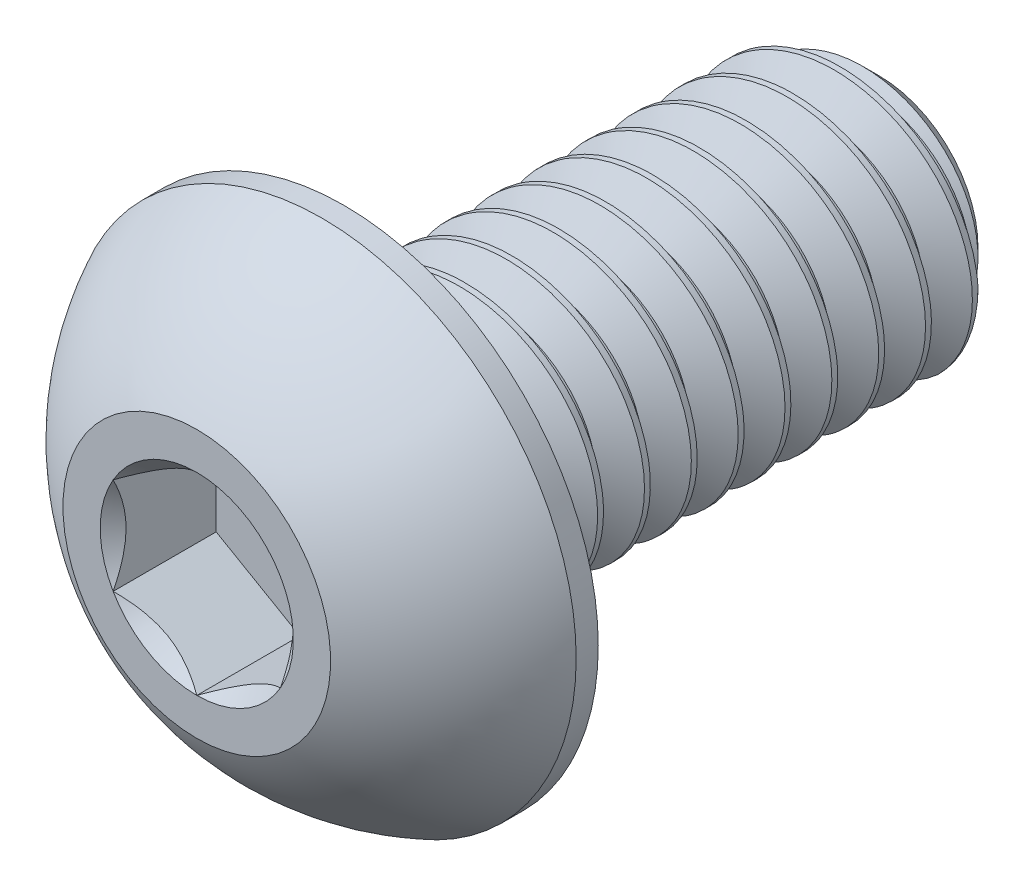
from build123d import *

# Parameters (mm, degrees)
SKETCH1_W          = 8
SKETCH1_H          = 2
CHAMFER1_SIZE      = 0.525
CUT_SWEEP1_PITCH   = 0.7
CUT_EXTRUDE2_DEPTH = 1.54


with BuildPart() as part:
    # Sketch1 → Revolve1 (revolve)
    with BuildSketch(Plane(origin=(0, 0, 0), x_dir=(0, 0, -1), z_dir=(1, 0, 0))):
        with Locations((6.2, 1)):
            Rectangle(SKETCH1_W, SKETCH1_H)
    revolve(axis=Axis((0, 0, -10.2), (0, 0, 1)))

    # Chamfer1
    chamfer1_edges = [part.edges().sort_by_distance(p)[0] for p in [
        (0, -2, -10.2),
    ]]
    chamfer(chamfer1_edges, length=CHAMFER1_SIZE)

    # Cut-Sweep1: the profile of Sketch2 profile screwed along a right-hand helix of 12.428571 turns, 6 arcs to a turn; built about Z, then put on its axis
    cut_sweep1_z = Axis((0, 0, 0), (0, 0, 1))
    cut_sweep1_corners = [(2.0003, 0, 0.000173205), (2.0003, 0, -0.612673205), (1.545336663, 0, -0.35), (1.545336663, 0, -0.2625)]
    with BuildLine(mode=Mode.PRIVATE) as cut_sweep1_profile:
        Line(cut_sweep1_corners[0], cut_sweep1_corners[1])
        Line(cut_sweep1_corners[1], cut_sweep1_corners[2])
        Line(cut_sweep1_corners[2], cut_sweep1_corners[3])
        Line(cut_sweep1_corners[3], cut_sweep1_corners[0])
    cut_sweep1_cap = Face(cut_sweep1_profile.wire())
    cut_sweep1_turn_angles = [0, 30, 60, 90, 120, 150, 180, 210, 240, 270, 300, 330, 360]
    cut_sweep1_turn_weights = [1, 0.8660254037844387, 1, 0.8660254037844387, 1, 0.8660254037844387, 1, 0.8660254037844387, 1, 0.8660254037844387, 1, 0.8660254037844387, 1]
    cut_sweep1_turn_rails = [Edge.make_bspline([Vector(p[0], p[1], 0).rotate(cut_sweep1_z, cut_sweep1_turn_angles[k]) / cut_sweep1_turn_weights[k] + Vector(0, 0, p[2] + CUT_SWEEP1_PITCH * cut_sweep1_turn_angles[k] / 360) for k in range(13)], [0, 0, 0, 1, 1, 2, 2, 3, 3, 4, 4, 5, 5, 6, 6, 6], 2, cut_sweep1_turn_weights) for p in cut_sweep1_corners]
    cut_sweep1_turn_sides = [Face.make_surface_from_curves(cut_sweep1_turn_rails[p[0]], cut_sweep1_turn_rails[p[1]]) for p in [(0, 1), (1, 2), (2, 3), (3, 0)]]
    cut_sweep1_last_angles = [4320, 4350, 4380, 4410, 4440, 4457.142857143, 4474.285714286]
    cut_sweep1_last_weights = [1, 0.8660254037844387, 1, 0.8660254037844387, 1, 0.9555728057861678, 1]
    cut_sweep1_last_rails = [Edge.make_bspline([Vector(p[0], p[1], 0).rotate(cut_sweep1_z, cut_sweep1_last_angles[k]) / cut_sweep1_last_weights[k] + Vector(0, 0, p[2] + CUT_SWEEP1_PITCH * cut_sweep1_last_angles[k] / 360) for k in range(7)], [0, 0, 0, 1, 1, 2, 2, 3, 3, 3], 2, cut_sweep1_last_weights) for p in cut_sweep1_corners]
    cut_sweep1_last_sides = [Face.make_surface_from_curves(cut_sweep1_last_rails[p[0]], cut_sweep1_last_rails[p[1]]) for p in [(0, 1), (1, 2), (2, 3), (3, 0)]]
    cut_sweep1 = Plane(origin=(0, 0, -10.2), x_dir=(0, 1, 0), z_dir=(0, 0, 1)) * Solid(Shell([*[p.moved(Location((0, 0, CUT_SWEEP1_PITCH * i))) for i in range(12) for p in cut_sweep1_turn_sides], *cut_sweep1_last_sides, cut_sweep1_cap, cut_sweep1_cap.rotate(cut_sweep1_z, 4474.285714286).moved(Location((0, 0, CUT_SWEEP1_PITCH * 4474.285714286 / 360)))]))
    add(cut_sweep1, mode=Mode.SUBTRACT)

    # Sketch7 → Revolve2 (revolve)
    with BuildSketch(Plane(origin=(0, 0, 0), x_dir=(0, 0, -1), z_dir=(1, 0, 0)), mode=Mode.PRIVATE) as revolve2_sk:
        with BuildLine():
            Line((1.87, 3.8), (2.2, 3.8))
            Line((2.2, 3.8), (2.2, 0))
            Line((2.2, 0), (0, 0))
            Line((0, 0), (0, 2))
            ThreePointArc((0, 2), (0.793500147, 3.047002626), (1.87, 3.8))
        make_face()
    revolve(revolve2_sk.sketch.rotate(Axis((0, 0, 0), (0, 0, -1)), 189.336081704), axis=Axis((0, 0, 0), (0, 0, -1)))

    # Sketch5 → Cut-Extrude2 (cut)
    with BuildSketch(Plane.XY):
        Polygon((1.25, -0.721687836), (1.25, 0.721687836), (0, 1.443375673), (-1.25, 0.721687836), (-1.25, -0.721687836), (0, -1.443375673), align=None)
    extrude(amount=-CUT_EXTRUDE2_DEPTH, mode=Mode.SUBTRACT)

    # Cut-Extrude3 cone 1 section (through the dimple's axis) → Cut-Extrude3 (revolve, cut)
    with BuildSketch(Plane(origin=(0, 0, 0), x_dir=(0, -1, 0), z_dir=(1, 0, 0))):
        Polygon((0, 0), (1.443375673, 0), (0, 1.443375673), align=None)
    revolve(axis=Axis((0, 0, 0), (0, 0, -1)), mode=Mode.SUBTRACT)


solid = part.part
